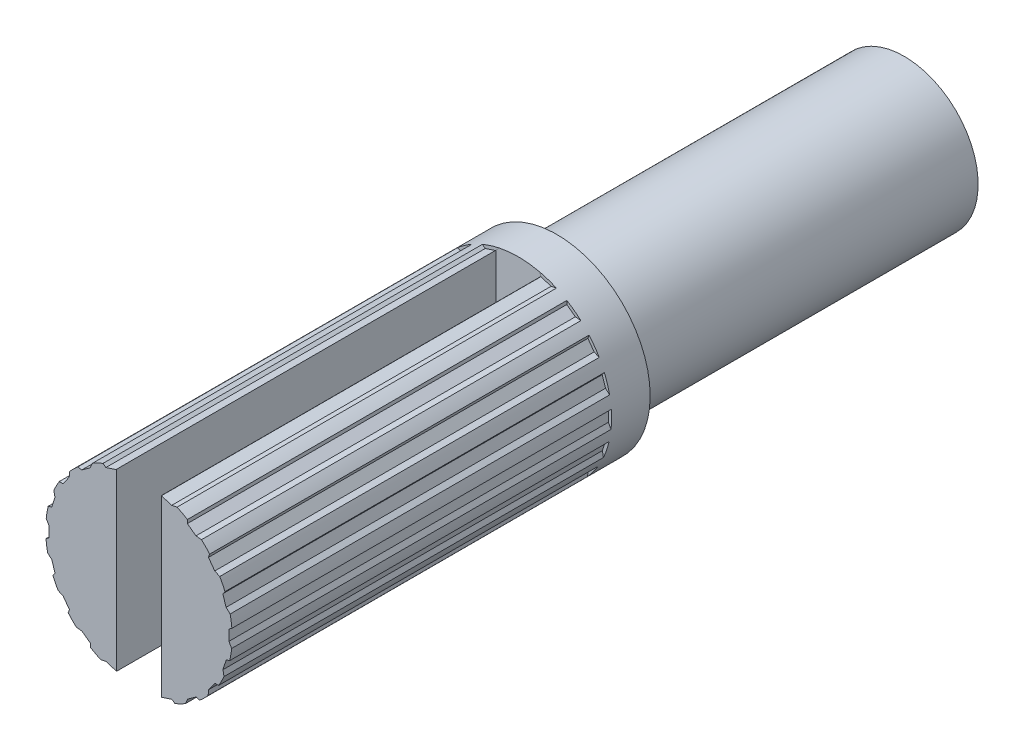
from build123d import *

# Parameters (mm, degrees)
SKETCH1_R           = 2.3
BOSS_EXTRUDE1_DEPTH = 5.4
BOSS_EXTRUDE2_START = 5.4
SKETCH2_R           = 2.9
BOSS_EXTRUDE2_DEPTH = 1.2
BOSS_EXTRUDE3_START = 6.6
BOSS_EXTRUDE3_DEPTH = 11.8
CHAMFER1_START      = 6.6
CHAMFER1_DEPTH      = 11.8


with BuildPart() as part:
    # Sketch1 → Boss-Extrude1 (new, symmetric)
    with BuildSketch(Plane.XY):
        with Locations(Location((0, 0, 0), (0, 0, 180))):
            Circle(SKETCH1_R)
    extrude(amount=BOSS_EXTRUDE1_DEPTH, both=True)

    # Sketch2 → Boss-Extrude2 (add)
    with BuildSketch(Plane.XY.offset(BOSS_EXTRUDE2_START)):
        Circle(SKETCH2_R)
    extrude(amount=BOSS_EXTRUDE2_DEPTH)

    # Sketch3 → Boss-Extrude3 (add)
    with BuildSketch(Plane.XY.offset(BOSS_EXTRUDE3_START)):
        with BuildLine():
            ThreePointArc((0.800510686, 2.787325356), (0.75037611, 2.801238243), (0.7, 2.814249456))
            Line((0.7, 2.814249456), (0.7, -2.814249456))
            ThreePointArc((0.7, -2.814249456), (0.75037611, -2.801238243), (0.800510686, -2.787325356))
            Line((0.800510686, -2.787325356), (0.769608986, -2.692219705))
            Line((0.769608986, -2.692219705), (0.864714638, -2.661318005))
            Line((0.864714638, -2.661318005), (0.959820289, -2.630416306))
            Line((0.959820289, -2.630416306), (0.990721989, -2.725521957))
            ThreePointArc((0.990721989, -2.725521957), (1.316572449, -2.58391892), (1.622661808, -2.403532537))
            Line((1.622661808, -2.403532537), (1.563883283, -2.322630838))
            Line((1.563883283, -2.322630838), (1.644784982, -2.263852312))
            Line((1.644784982, -2.263852312), (1.725686682, -2.205073787))
            Line((1.725686682, -2.205073787), (1.784465207, -2.285975487))
            ThreePointArc((1.784465207, -2.285975487), (2.050609665, -2.050609665), (2.285975487, -1.784465207))
            Line((2.285975487, -1.784465207), (2.205073787, -1.725686682))
            Line((2.205073787, -1.725686682), (2.263852312, -1.644784982))
            Line((2.263852312, -1.644784982), (2.322630838, -1.563883283))
            Line((2.322630838, -1.563883283), (2.403532537, -1.622661808))
            ThreePointArc((2.403532537, -1.622661808), (2.58391892, -1.316572449), (2.725521957, -0.990721989))
            Line((2.725521957, -0.990721989), (2.630416306, -0.959820289))
            Line((2.630416306, -0.959820289), (2.661318005, -0.864714638))
            Line((2.661318005, -0.864714638), (2.692219705, -0.769608986))
            Line((2.692219705, -0.769608986), (2.787325356, -0.800510686))
            ThreePointArc((2.787325356, -0.800510686), (2.864296188, -0.453659949), (2.898275349, -0.1))
            Line((2.898275349, -0.1), (2.798275349, -0.1))
            Line((2.798275349, -0.1), (2.798275349, 0))
            Line((2.798275349, 0), (2.798275349, 0.1))
            Line((2.798275349, 0.1), (2.898275349, 0.1))
            ThreePointArc((2.898275349, 0.1), (2.864296188, 0.453659949), (2.787325356, 0.800510686))
            Line((2.787325356, 0.800510686), (2.692219705, 0.769608986))
            Line((2.692219705, 0.769608986), (2.661318005, 0.864714638))
            Line((2.661318005, 0.864714638), (2.630416306, 0.959820289))
            Line((2.630416306, 0.959820289), (2.725521957, 0.990721989))
            ThreePointArc((2.725521957, 0.990721989), (2.58391892, 1.316572449), (2.403532537, 1.622661808))
            Line((2.403532537, 1.622661808), (2.322630838, 1.563883283))
            Line((2.322630838, 1.563883283), (2.263852312, 1.644784982))
            Line((2.263852312, 1.644784982), (2.205073787, 1.725686682))
            Line((2.205073787, 1.725686682), (2.285975487, 1.784465207))
            ThreePointArc((2.285975487, 1.784465207), (2.050609665, 2.050609665), (1.784465207, 2.285975487))
            Line((1.784465207, 2.285975487), (1.725686682, 2.205073787))
            Line((1.725686682, 2.205073787), (1.644784982, 2.263852312))
            Line((1.644784982, 2.263852312), (1.563883283, 2.322630838))
            Line((1.563883283, 2.322630838), (1.622661808, 2.403532537))
            ThreePointArc((1.622661808, 2.403532537), (1.316572449, 2.58391892), (0.990721989, 2.725521957))
            Line((0.990721989, 2.725521957), (0.959820289, 2.630416306))
            Line((0.959820289, 2.630416306), (0.864714638, 2.661318005))
            Line((0.864714638, 2.661318005), (0.769608986, 2.692219705))
            Line((0.769608986, 2.692219705), (0.800510686, 2.787325356))
        make_face()
        with BuildLine():
            Line((-2.798275349, 0), (-0.7, 0))
            Line((-0.7, 0), (-0.7, 2.814249456))
            ThreePointArc((-0.7, 2.814249456), (-0.75037611, 2.801238243), (-0.800510686, 2.787325356))
            Line((-0.800510686, 2.787325356), (-0.769608986, 2.692219705))
            Line((-0.769608986, 2.692219705), (-0.864714638, 2.661318005))
            Line((-0.864714638, 2.661318005), (-0.959820289, 2.630416306))
            Line((-0.959820289, 2.630416306), (-0.990721989, 2.725521957))
            ThreePointArc((-0.990721989, 2.725521957), (-1.316572449, 2.58391892), (-1.622661808, 2.403532537))
            Line((-1.622661808, 2.403532537), (-1.563883283, 2.322630838))
            Line((-1.563883283, 2.322630838), (-1.644784982, 2.263852312))
            Line((-1.644784982, 2.263852312), (-1.725686682, 2.205073787))
            Line((-1.725686682, 2.205073787), (-1.784465207, 2.285975487))
            ThreePointArc((-1.784465207, 2.285975487), (-2.050609665, 2.050609665), (-2.285975487, 1.784465207))
            Line((-2.285975487, 1.784465207), (-2.205073787, 1.725686682))
            Line((-2.205073787, 1.725686682), (-2.263852312, 1.644784982))
            Line((-2.263852312, 1.644784982), (-2.322630838, 1.563883283))
            Line((-2.322630838, 1.563883283), (-2.403532537, 1.622661808))
            ThreePointArc((-2.403532537, 1.622661808), (-2.58391892, 1.316572449), (-2.725521957, 0.990721989))
            Line((-2.725521957, 0.990721989), (-2.630416306, 0.959820289))
            Line((-2.630416306, 0.959820289), (-2.661318005, 0.864714638))
            Line((-2.661318005, 0.864714638), (-2.692219705, 0.769608986))
            Line((-2.692219705, 0.769608986), (-2.787325356, 0.800510686))
            ThreePointArc((-2.787325356, 0.800510686), (-2.864296188, 0.453659949), (-2.898275349, 0.1))
            Line((-2.898275349, 0.1), (-2.798275349, 0.1))
            Line((-2.798275349, 0.1), (-2.798275349, 0))
        make_face()
        with BuildLine():
            Line((-0.7, -2.814249456), (-0.7, 0))
            Line((-0.7, 0), (-2.798275349, 0))
            Line((-2.798275349, 0), (-2.798275349, -0.1))
            Line((-2.798275349, -0.1), (-2.898275349, -0.1))
            ThreePointArc((-2.898275349, -0.1), (-2.864296188, -0.453659949), (-2.787325356, -0.800510686))
            Line((-2.787325356, -0.800510686), (-2.692219705, -0.769608986))
            Line((-2.692219705, -0.769608986), (-2.661318005, -0.864714638))
            Line((-2.661318005, -0.864714638), (-2.630416306, -0.959820289))
            Line((-2.630416306, -0.959820289), (-2.725521957, -0.990721989))
            ThreePointArc((-2.725521957, -0.990721989), (-2.58391892, -1.316572449), (-2.403532537, -1.622661808))
            Line((-2.403532537, -1.622661808), (-2.322630838, -1.563883283))
            Line((-2.322630838, -1.563883283), (-2.263852312, -1.644784982))
            Line((-2.263852312, -1.644784982), (-2.205073787, -1.725686682))
            Line((-2.205073787, -1.725686682), (-2.285975487, -1.784465207))
            ThreePointArc((-2.285975487, -1.784465207), (-2.050609665, -2.050609665), (-1.784465207, -2.285975487))
            Line((-1.784465207, -2.285975487), (-1.725686682, -2.205073787))
            Line((-1.725686682, -2.205073787), (-1.644784982, -2.263852312))
            Line((-1.644784982, -2.263852312), (-1.563883283, -2.322630838))
            Line((-1.563883283, -2.322630838), (-1.622661808, -2.403532537))
            ThreePointArc((-1.622661808, -2.403532537), (-1.316572449, -2.58391892), (-0.990721989, -2.725521957))
            Line((-0.990721989, -2.725521957), (-0.959820289, -2.630416306))
            Line((-0.959820289, -2.630416306), (-0.864714638, -2.661318005))
            Line((-0.864714638, -2.661318005), (-0.769608986, -2.692219705))
            Line((-0.769608986, -2.692219705), (-0.800510686, -2.787325356))
            ThreePointArc((-0.800510686, -2.787325356), (-0.75037611, -2.801238243), (-0.7, -2.814249456))
        make_face()
    extrude(amount=BOSS_EXTRUDE3_DEPTH)

    # Chamfer1: read off the stored shape, not the designer's step
    # Chamfer1 outline → Chamfer1 (cut)
    with BuildSketch(Plane.XY.offset(CHAMFER1_START)):
        with BuildLine():
            Line((2.890362517, 0.236229809), (2.798275349, 0.171923694))
            Line((2.798275349, 0.171923694), (2.798275349, 0.1))
            Line((2.798275349, 0.1), (2.898275349, 0.1))
            ThreePointArc((2.898275349, 0.1), (2.89512033, 0.168161453), (2.890362517, 0.236229809))
        make_face()
        with BuildLine():
            Line((2.898275349, -0.1), (2.798275349, -0.1))
            Line((2.798275349, -0.1), (2.798275349, -0.159867812))
            Line((2.798275349, -0.159867812), (2.883541046, -0.308530446))
            ThreePointArc((2.883541046, -0.308530446), (2.892787832, -0.204398034), (2.898275349, -0.1))
        make_face()
        with BuildLine():
            Line((2.710719876, 0.712671314), (2.837751653, 0.597633297))
            ThreePointArc((2.837751653, 0.597633297), (2.814367184, 0.69952652), (2.787325356, 0.800510686))
            Line((2.787325356, 0.800510686), (2.692219705, 0.769608986))
            Line((2.692219705, 0.769608986), (2.710719876, 0.712671314))
        make_face()
        with BuildLine():
            Line((2.630416306, 0.959820289), (2.725521957, 0.990721989))
            ThreePointArc((2.725521957, 0.990721989), (2.701458308, 1.054572429), (2.67589908, 1.117839037))
            Line((2.67589908, 1.117839037), (2.608190662, 1.028223787))
            Line((2.608190662, 1.028223787), (2.630416306, 0.959820289))
        make_face()
        with BuildLine():
            ThreePointArc((2.787325356, -0.800510686), (2.805387802, -0.734710337), (2.821897132, -0.668503238))
            Line((2.821897132, -0.668503238), (2.714445348, -0.701205489))
            Line((2.714445348, -0.701205489), (2.692219705, -0.769608986))
            Line((2.692219705, -0.769608986), (2.787325356, -0.800510686))
        make_face()
        with BuildLine():
            Line((2.357820254, 1.515449206), (2.514183356, 1.445296528))
            ThreePointArc((2.514183356, 1.445296528), (2.460456667, 1.534976543), (2.403532537, 1.622661808))
            Line((2.403532537, 1.622661808), (2.322630838, 1.563883283))
            Line((2.322630838, 1.563883283), (2.357820254, 1.515449206))
        make_face()
        with BuildLine():
            ThreePointArc((2.647069351, -1.184493078), (2.688042252, -1.088314683), (2.725521957, -0.990721989))
            Line((2.725521957, -0.990721989), (2.630416306, -0.959820289))
            Line((2.630416306, -0.959820289), (2.611916135, -1.016757962))
            Line((2.611916135, -1.016757962), (2.647069351, -1.184493078))
        make_face()
        with BuildLine():
            Line((2.205073787, 1.725686682), (2.285975487, 1.784465207))
            ThreePointArc((2.285975487, 1.784465207), (2.243358726, 1.837754507), (2.199499998, 1.890026391))
            Line((2.199499998, 1.890026391), (2.162798101, 1.783874172))
            Line((2.162798101, 1.783874172), (2.205073787, 1.725686682))
        make_face()
        with BuildLine():
            ThreePointArc((2.403532537, -1.622661808), (2.44104437, -1.56566356), (2.477204794, -1.507798531))
            Line((2.477204794, -1.507798531), (2.364906524, -1.505695792))
            Line((2.364906524, -1.505695792), (2.322630837, -1.563883283))
            Line((2.322630837, -1.563883283), (2.403532537, -1.622661808))
        make_face()
        with BuildLine():
            Line((1.774120759, 2.16988437), (1.944509275, 2.151484064))
            ThreePointArc((1.944509275, 2.151484064), (1.865699509, 2.220172368), (1.784465207, 2.285975487))
            Line((1.784465207, 2.285975487), (1.725686682, 2.205073787))
            Line((1.725686682, 2.205073787), (1.774120759, 2.16988437))
        make_face()
        with BuildLine():
            ThreePointArc((2.151484064, -1.944509275), (2.220172368, -1.865699509), (2.285975487, -1.784465207))
            Line((2.285975487, -1.784465207), (2.205073787, -1.725686682))
            Line((2.205073787, -1.725686682), (2.16988437, -1.774120759))
            Line((2.16988437, -1.774120759), (2.151484064, -1.944509275))
        make_face()
        with BuildLine():
            Line((1.563883283, 2.322630838), (1.622661808, 2.403532537))
            ThreePointArc((1.622661808, 2.403532537), (1.56566356, 2.44104437), (1.507798531, 2.477204794))
            Line((1.507798531, 2.477204794), (1.505695792, 2.364906524))
            Line((1.505695792, 2.364906524), (1.563883283, 2.322630838))
        make_face()
        with BuildLine():
            ThreePointArc((1.784465207, -2.285975487), (1.837754507, -2.243358726), (1.890026391, -2.199499998))
            Line((1.890026391, -2.199499998), (1.783874172, -2.162798101))
            Line((1.783874172, -2.162798101), (1.725686682, -2.205073787))
            Line((1.725686682, -2.205073787), (1.784465207, -2.285975487))
        make_face()
        with BuildLine():
            Line((1.016757962, 2.611916135), (1.184493078, 2.647069351))
            ThreePointArc((1.184493078, 2.647069351), (1.088314683, 2.688042252), (0.990721989, 2.725521957))
            Line((0.990721989, 2.725521957), (0.959820289, 2.630416306))
            Line((0.959820289, 2.630416306), (1.016757962, 2.611916135))
        make_face()
        with BuildLine():
            ThreePointArc((1.445296528, -2.514183356), (1.534976543, -2.460456667), (1.622661808, -2.403532537))
            Line((1.622661808, -2.403532537), (1.563883283, -2.322630838))
            Line((1.563883283, -2.322630838), (1.515449206, -2.357820254))
            Line((1.515449206, -2.357820254), (1.445296528, -2.514183356))
        make_face()
        with BuildLine():
            Line((0.769608986, 2.692219705), (0.800510686, 2.787325356))
            ThreePointArc((0.800510686, 2.787325356), (0.75037611, 2.801238243), (0.7, 2.814249456))
            Line((0.7, 2.814249456), (0.7, 2.718406296))
            Line((0.7, 2.718406296), (0.701205489, 2.714445348))
            Line((0.701205489, 2.714445348), (0.769608986, 2.692219705))
        make_face()
        with BuildLine():
            ThreePointArc((0.990721989, -2.725521957), (1.054572429, -2.701458308), (1.117839037, -2.67589908))
            Line((1.117839037, -2.67589908), (1.028223787, -2.608190662))
            Line((1.028223787, -2.608190662), (0.959820289, -2.630416306))
            Line((0.959820289, -2.630416306), (0.990721989, -2.725521957))
        make_face()
        with BuildLine():
            Line((-0.7, 2.72471229), (-0.7, 2.814249456))
            ThreePointArc((-0.7, 2.814249456), (-0.75037611, 2.801238243), (-0.800510686, 2.787325356))
            Line((-0.800510686, 2.787325356), (-0.769608986, 2.692219705))
            Line((-0.769608986, 2.692219705), (-0.712671314, 2.710719876))
            Line((-0.712671314, 2.710719876), (-0.7, 2.72471229))
        make_face()
        with BuildLine():
            ThreePointArc((0.7, -2.814249456), (0.75037611, -2.801238243), (0.800510686, -2.787325356))
            Line((0.800510686, -2.787325356), (0.769608986, -2.692219705))
            Line((0.769608986, -2.692219705), (0.712671314, -2.710719876))
            Line((0.712671314, -2.710719876), (0.7, -2.72471229))
            Line((0.7, -2.72471229), (0.7, -2.814249456))
        make_face()
        with BuildLine():
            Line((-0.959820289, 2.630416306), (-0.990721989, 2.725521957))
            ThreePointArc((-0.990721989, 2.725521957), (-1.054572429, 2.701458308), (-1.117839037, 2.67589908))
            Line((-1.117839037, 2.67589908), (-1.028223787, 2.608190662))
            Line((-1.028223787, 2.608190662), (-0.959820289, 2.630416306))
        make_face()
        with BuildLine():
            Line((-0.7, -2.814249456), (-0.7, -2.718406296))
            Line((-0.7, -2.718406296), (-0.701205489, -2.714445348))
            Line((-0.701205489, -2.714445348), (-0.769608986, -2.692219705))
            Line((-0.769608986, -2.692219705), (-0.800510686, -2.787325356))
            ThreePointArc((-0.800510686, -2.787325356), (-0.75037611, -2.801238243), (-0.7, -2.814249456))
        make_face()
        with BuildLine():
            Line((-1.515449206, 2.357820254), (-1.445296528, 2.514183356))
            ThreePointArc((-1.445296528, 2.514183356), (-1.534976543, 2.460456667), (-1.622661808, 2.403532537))
            Line((-1.622661808, 2.403532537), (-1.563883283, 2.322630838))
            Line((-1.563883283, 2.322630838), (-1.515449206, 2.357820254))
        make_face()
        with BuildLine():
            ThreePointArc((-1.184493078, -2.647069351), (-1.088314683, -2.688042252), (-0.990721989, -2.725521957))
            Line((-0.990721989, -2.725521957), (-0.959820289, -2.630416306))
            Line((-0.959820289, -2.630416306), (-1.016757962, -2.611916135))
            Line((-1.016757962, -2.611916135), (-1.184493078, -2.647069351))
        make_face()
        with BuildLine():
            Line((-1.725686682, 2.205073787), (-1.784465207, 2.285975487))
            ThreePointArc((-1.784465207, 2.285975487), (-1.837754507, 2.243358726), (-1.890026391, 2.199499998))
            Line((-1.890026391, 2.199499998), (-1.783874172, 2.162798101))
            Line((-1.783874172, 2.162798101), (-1.725686682, 2.205073787))
        make_face()
        with BuildLine():
            ThreePointArc((-1.622661808, -2.403532537), (-1.56566356, -2.44104437), (-1.507798531, -2.477204794))
            Line((-1.507798531, -2.477204794), (-1.505695792, -2.364906524))
            Line((-1.505695792, -2.364906524), (-1.563883283, -2.322630837))
            Line((-1.563883283, -2.322630837), (-1.622661808, -2.403532537))
        make_face()
        with BuildLine():
            Line((-2.16988437, 1.774120759), (-2.151484064, 1.944509275))
            ThreePointArc((-2.151484064, 1.944509275), (-2.220172368, 1.865699509), (-2.285975487, 1.784465207))
            Line((-2.285975487, 1.784465207), (-2.205073787, 1.725686682))
            Line((-2.205073787, 1.725686682), (-2.16988437, 1.774120759))
        make_face()
        with BuildLine():
            ThreePointArc((-1.944509275, -2.151484064), (-1.865699509, -2.220172368), (-1.784465207, -2.285975487))
            Line((-1.784465207, -2.285975487), (-1.725686682, -2.205073787))
            Line((-1.725686682, -2.205073787), (-1.774120759, -2.16988437))
            Line((-1.774120759, -2.16988437), (-1.944509275, -2.151484064))
        make_face()
        with BuildLine():
            Line((-2.322630838, 1.563883283), (-2.403532537, 1.622661808))
            ThreePointArc((-2.403532537, 1.622661808), (-2.44104437, 1.56566356), (-2.477204794, 1.507798531))
            Line((-2.477204794, 1.507798531), (-2.364906524, 1.505695792))
            Line((-2.364906524, 1.505695792), (-2.322630838, 1.563883283))
        make_face()
        with BuildLine():
            ThreePointArc((-2.285975487, -1.784465207), (-2.243358726, -1.837754507), (-2.199499998, -1.890026391))
            Line((-2.199499998, -1.890026391), (-2.162798101, -1.783874172))
            Line((-2.162798101, -1.783874172), (-2.205073787, -1.725686682))
            Line((-2.205073787, -1.725686682), (-2.285975487, -1.784465207))
        make_face()
        with BuildLine():
            Line((-2.611916135, 1.016757962), (-2.647069351, 1.184493078))
            ThreePointArc((-2.647069351, 1.184493078), (-2.688042252, 1.088314683), (-2.725521957, 0.990721989))
            Line((-2.725521957, 0.990721989), (-2.630416306, 0.959820289))
            Line((-2.630416306, 0.959820289), (-2.611916135, 1.016757962))
        make_face()
        with BuildLine():
            ThreePointArc((-2.514183356, -1.445296528), (-2.460456667, -1.534976543), (-2.403532537, -1.622661808))
            Line((-2.403532537, -1.622661808), (-2.322630838, -1.563883283))
            Line((-2.322630838, -1.563883283), (-2.357820254, -1.515449206))
            Line((-2.357820254, -1.515449206), (-2.514183356, -1.445296528))
        make_face()
        with BuildLine():
            Line((-2.692219705, 0.769608986), (-2.787325356, 0.800510686))
            ThreePointArc((-2.787325356, 0.800510686), (-2.805387802, 0.734710337), (-2.821897132, 0.668503238))
            Line((-2.821897132, 0.668503238), (-2.714445348, 0.701205489))
            Line((-2.714445348, 0.701205489), (-2.692219705, 0.769608986))
        make_face()
        with BuildLine():
            ThreePointArc((-2.725521957, -0.990721989), (-2.701458308, -1.054572429), (-2.67589908, -1.117839037))
            Line((-2.67589908, -1.117839037), (-2.608190662, -1.028223787))
            Line((-2.608190662, -1.028223787), (-2.630416306, -0.959820289))
            Line((-2.630416306, -0.959820289), (-2.725521957, -0.990721989))
        make_face()
        with BuildLine():
            Line((-2.798275349, 0.159867812), (-2.883541046, 0.308530446))
            ThreePointArc((-2.883541046, 0.308530446), (-2.892787832, 0.204398034), (-2.898275349, 0.1))
            Line((-2.898275349, 0.1), (-2.798275349, 0.1))
            Line((-2.798275349, 0.1), (-2.798275349, 0.159867812))
        make_face()
        with BuildLine():
            ThreePointArc((-2.837751653, -0.597633297), (-2.814367184, -0.69952652), (-2.787325356, -0.800510686))
            Line((-2.787325356, -0.800510686), (-2.692219705, -0.769608986))
            Line((-2.692219705, -0.769608986), (-2.710719876, -0.712671314))
            Line((-2.710719876, -0.712671314), (-2.837751653, -0.597633297))
        make_face()
        with BuildLine():
            Line((-2.798275349, -0.1), (-2.898275349, -0.1))
            ThreePointArc((-2.898275349, -0.1), (-2.89512033, -0.168161453), (-2.890362517, -0.236229809))
            Line((-2.890362517, -0.236229809), (-2.798275349, -0.171923694))
            Line((-2.798275349, -0.171923694), (-2.798275349, -0.1))
        make_face()
    extrude(amount=CHAMFER1_DEPTH, mode=Mode.SUBTRACT)


solid = part.part
